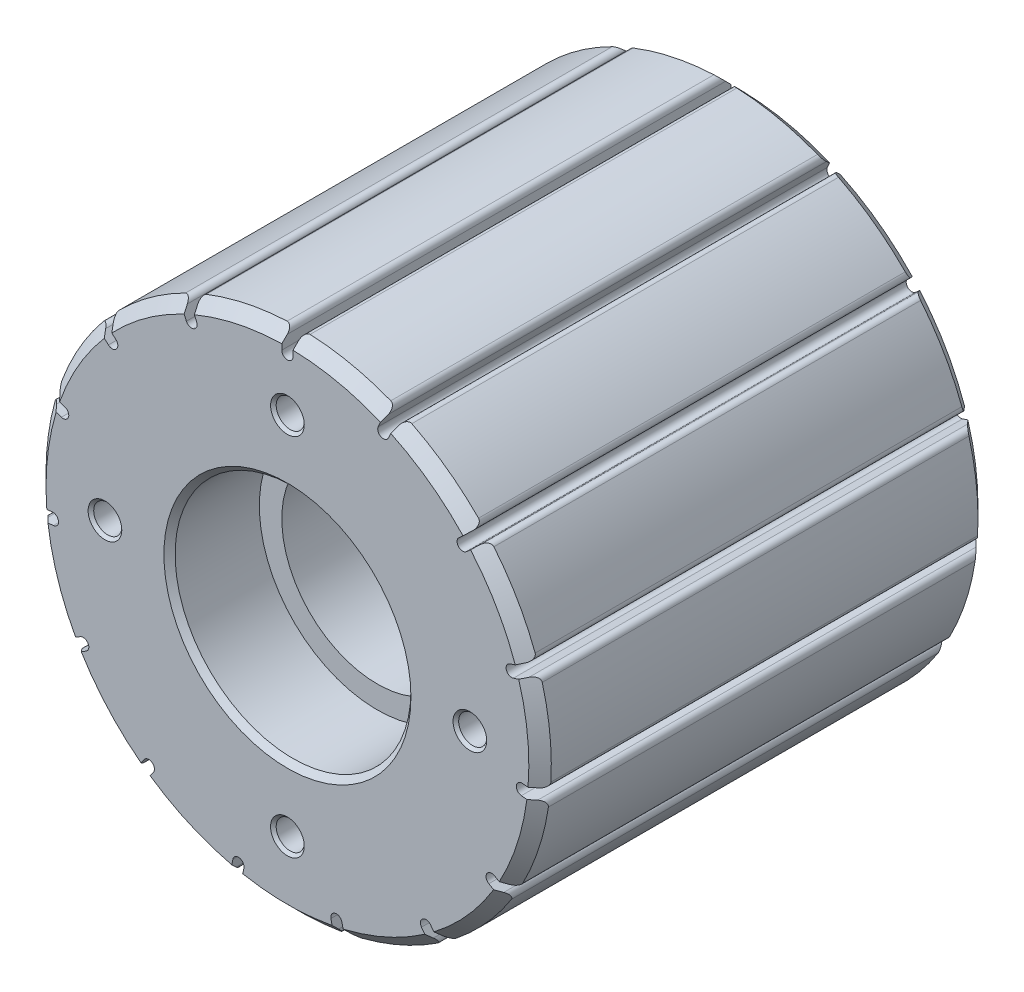
from build123d import *

# Parameters (mm, degrees)
SKETCH2_R                    = 45
SKETCH2_R_2                  = 21
BOSS_EXTRUDE1_DEPTH          = 40
CHAMFER3_SIZE                = 2
CUT_EXTRUDE1_DEPTH           = 76.166481892
FILLET1_R                    = 1
CIRPATTERN1_COUNT            = 15
FILLET1_OF_CIRPATTERN1_R     = 1
SKETCH4_R                    = 21
SKETCH4_R_2                  = 17
BOSS_EXTRUDE2_DEPTH          = 24
SKETCH6_W                    = 1.85
SKETCH6_H                    = 23.75
CHAMFER2_SIZE                = 1
SKETCH8_R                    = 2.5
CUT_EXTRUDE2_DEPTH           = 25
CHAMFER1_SIZE                = 0.5
CIRPATTERN2_COUNT            = 4
CHAMFER1_OF_CIRPATTERN2_SIZE = 0.5


with BuildPart() as part:
    # Sketch2 → Boss-Extrude1 (new, symmetric)
    with BuildSketch(Plane.XY):
        Circle(SKETCH2_R)
        Circle(SKETCH2_R_2, mode=Mode.SUBTRACT)
    extrude(amount=BOSS_EXTRUDE1_DEPTH, both=True)

    # Chamfer3
    chamfer3_edges = [part.edges().sort_by_distance(p)[0] for p in [
        (-45, 0, 40),
        (-45, 0, -40),
    ]]
    chamfer(chamfer3_edges, length=CHAMFER3_SIZE)

    # Sketch3 → Cut-Extrude1 (cut, symmetric)
    with BuildSketch(Plane.XY):
        with BuildLine():
            Line((1, 45), (1, 42))
            ThreePointArc((1, 42), (0, 41), (-1, 42))
            Line((-1, 42), (-1, 45))
            ThreePointArc((-1, 45), (0, 46), (1, 45))
        make_face()
    cut_extrude1 = extrude(amount=CUT_EXTRUDE1_DEPTH, both=True, mode=Mode.SUBTRACT)

    # Fillet1
    fillet1_edges = [part.edges().sort_by_distance(p)[0] for p in [
        (-1, 44.988887517, 0),
        (1, 44.988887517, 0),
    ]]
    fillet(fillet1_edges, radius=FILLET1_R)

    # CirPattern1: Cut-Extrude1 ×15 about axis
    cirpattern1_axis = Axis((0, 0, 40), (0, 0, -1))
    for i in range(1, CIRPATTERN1_COUNT):
        add(cut_extrude1.rotate(cirpattern1_axis, i * 360 / CIRPATTERN1_COUNT), mode=Mode.SUBTRACT)

    # Fillet1 of CirPattern1
    fillet1_of_cirpattern1_edges = [part.edges().sort_by_distance(p)[0] for p in [
        (17.385083627, 41.506130478, 0),
        (19.212174542, 40.692657192, 0),
        (32.764128356, 30.846586409, 0),
        (34.102389568, 29.360296758, 0),
        (42.477957639, 14.853387317, 0),
        (43.095991628, 12.951274284, 0),
        (44.846962147, -3.708097381, 0),
        (44.63790522, -5.697141172, 0),
        (39.461519478, -21.628418355, 0),
        (38.461519478, -23.360469162, 0),
        (27.252821594, -35.808989307, 0),
        (25.634787605, -36.984559811, 0),
        (10.331863272, -43.797860693, 0),
        (8.375568071, -44.213684075, 0),
        (-8.375568071, -44.213684075, 0),
        (-10.331863272, -43.797860693, 0),
        (-25.634787605, -36.984559811, 0),
        (-27.252821594, -35.808989307, 0),
        (-38.461519478, -23.360469162, 0),
        (-39.461519478, -21.628418355, 0),
        (-44.63790522, -5.697141172, 0),
        (-44.846962147, -3.708097381, 0),
        (-43.095991628, 12.951274284, 0),
        (-42.477957639, 14.853387317, 0),
        (-34.102389568, 29.360296758, 0),
        (-32.764128356, 30.846586409, 0),
        (-19.212174542, 40.692657192, 0),
        (-17.385083627, 41.506130478, 0),
    ]]
    fillet(fillet1_of_cirpattern1_edges, radius=FILLET1_OF_CIRPATTERN1_R)

    # Sketch4 → Boss-Extrude2 (add, symmetric)
    with BuildSketch(Plane.XY):
        Circle(SKETCH4_R)
        Circle(SKETCH4_R_2, mode=Mode.SUBTRACT)
    extrude(amount=BOSS_EXTRUDE2_DEPTH, both=True)

    # Sketch6 → Cut-Revolve1 (revolve, cut)
    with BuildSketch(Plane(origin=(0, 0, 0), x_dir=(0, 0, -1), z_dir=(1, 0, 0))):
        with Locations((36.825, -11.875)):
            Rectangle(SKETCH6_W, SKETCH6_H)
    revolve(axis=Axis((0, 0, 0), (0, 0, -1)), mode=Mode.SUBTRACT)

    # Chamfer2
    chamfer2_edges = [part.edges().sort_by_distance(p)[0] for p in [
        (-21, 0, -40),
        (-21, 0, 40),
    ]]
    chamfer(chamfer2_edges, length=CHAMFER2_SIZE)

    # Sketch8 → Cut-Extrude2 (cut)
    with BuildSketch(Plane.XY.offset(40)):
        with Locations((0, 32.5)):
            Circle(SKETCH8_R)
    cut_extrude2 = extrude(amount=-CUT_EXTRUDE2_DEPTH, mode=Mode.SUBTRACT)

    # Cut-Extrude3 cone 1 section (through the dimple's axis) → Cut-Extrude3 (revolve, cut)
    with BuildSketch(Plane(origin=(0, 32.5, 15), x_dir=(0, -1, 0), z_dir=(1, 0, 0))):
        Polygon((0, 0), (2.5, 0), (0, 1.165769145), align=None)
    cut_extrude3 = revolve(axis=Axis((0, 32.5, 15), (0, 0, -1)), mode=Mode.SUBTRACT)

    # Chamfer1
    chamfer1_edges = [part.edges().sort_by_distance(p)[0] for p in [
        (-2.5, 32.5, 40),
    ]]
    chamfer(chamfer1_edges, length=CHAMFER1_SIZE)

    # CirPattern2: Cut-Extrude2, Cut-Extrude3 ×4 about axis
    cirpattern2_axis = Axis((0, 0, 40), (0, 0, -1))
    add([cut_extrude2.rotate(cirpattern2_axis, i * 360 / CIRPATTERN2_COUNT) for i in range(1, CIRPATTERN2_COUNT)], mode=Mode.SUBTRACT)
    add([cut_extrude3.rotate(cirpattern2_axis, i * 360 / CIRPATTERN2_COUNT) for i in range(1, CIRPATTERN2_COUNT)], mode=Mode.SUBTRACT)

    # Chamfer1 of CirPattern2
    chamfer1_of_cirpattern2_edges = [part.edges().sort_by_distance(p)[0] for p in [
        (32.5, 2.5, 40),
        (2.5, -32.5, 40),
        (-32.5, -2.5, 40),
    ]]
    chamfer(chamfer1_of_cirpattern2_edges, length=CHAMFER1_OF_CIRPATTERN2_SIZE)


solid = part.part
